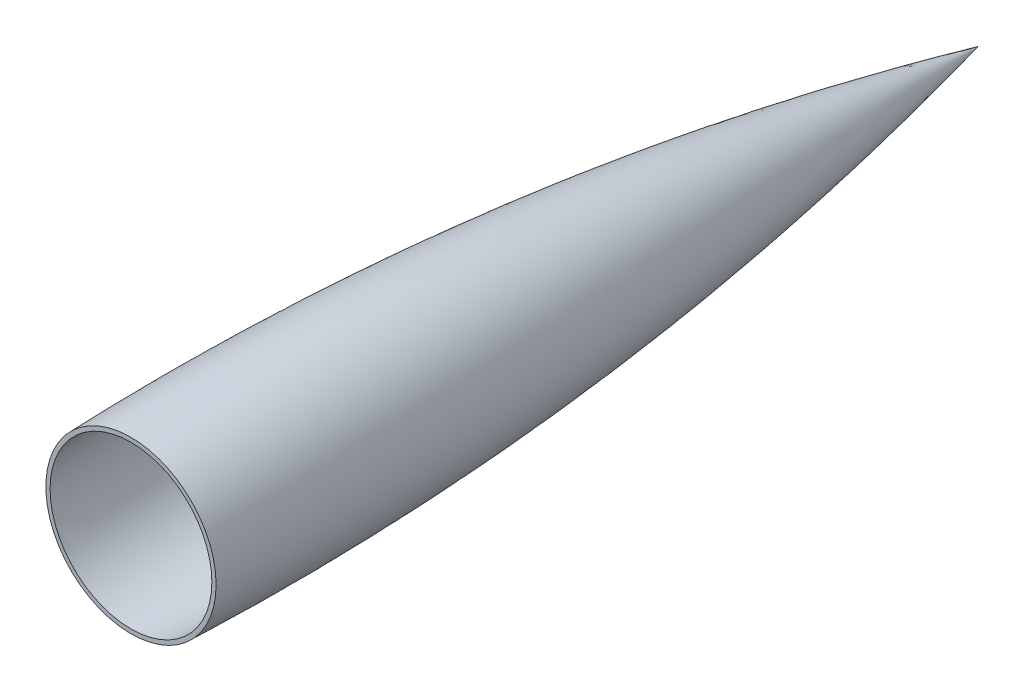
from build123d import *


# Read off the part's stored shape, not the designer's step: Shell1
with BuildPart() as part:
    # Sketch1 → Revolve1 (revolve)
    with BuildSketch(Plane(origin=(0, 0, 0), x_dir=(1, 0, 0), z_dir=(0, 1, 0))):
        with BuildLine():
            Line((0, 0), (51.054, 0))
            Line((51.054, 0), (51.054, 508))
            ThreePointArc((51.054, 508), (9.054840571, 255.655452023), (0, 0))
        make_face()
    revolve(axis=Axis((51.054, 0, 0), (0, 0, -1)))

    # Shell1 outline → Shell1 (revolve, cut)
    with BuildSketch(Plane(origin=(51.054, 0, 0), x_dir=(1, 0, 0), z_dir=(0, -1, 0))):
        with BuildLine():
            Line((0, 0), (0, -496.709022754))
            add(Edge.make_bspline(
                [(0, -496.709022754), (55.906224783, -251.445702227), (48.512903669, 0)],
                knots=[6.059070797, 6.059070797, 6.059070797, 6.312580089, 6.312580089, 6.312580089], degree=2, weights=[1, 0.99197738, 1]))
            Line((48.512903669, 0), (0, 0))
        make_face()
    revolve(axis=Axis((51.054, 0, 0), (0, 0, 1)), mode=Mode.SUBTRACT)


solid = part.part
